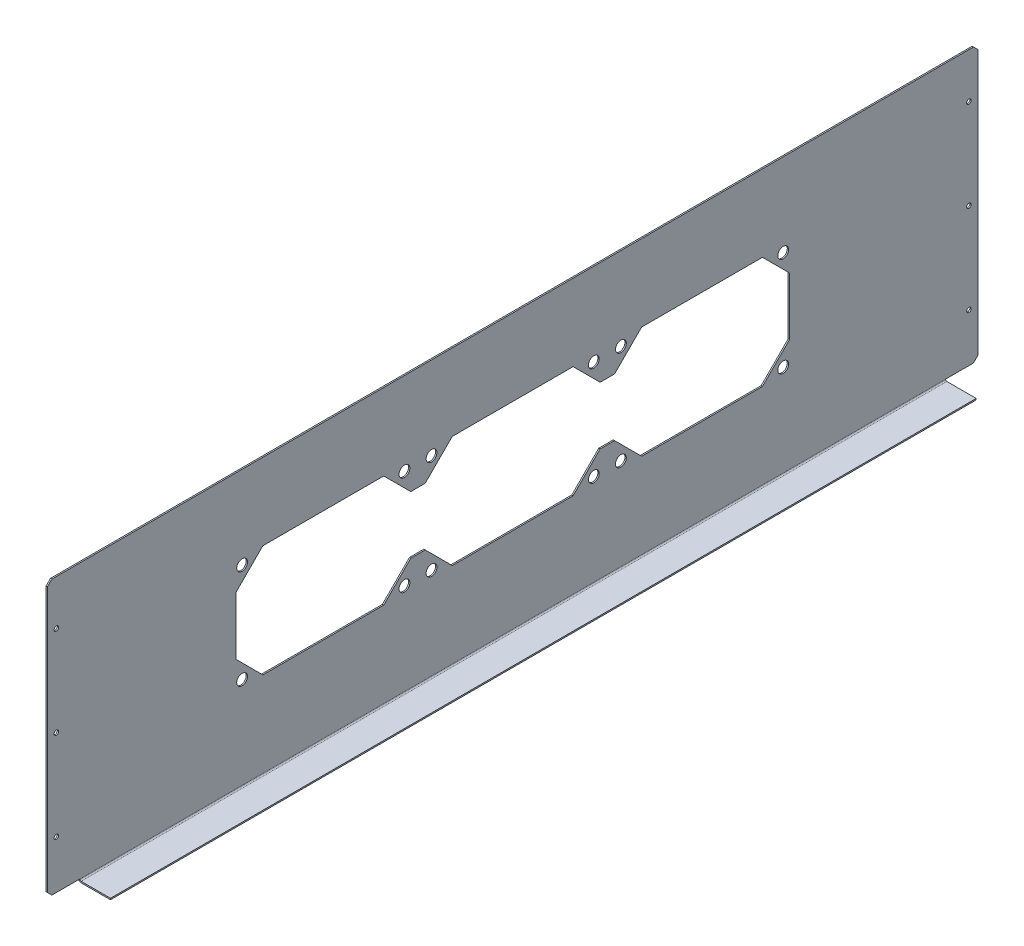
from build123d import *

# Parameters (mm, degrees)
SM_BASE_FLANGE_1_DEPTH = 516
SKETCH_7_W             = 36
SKETCH_7_H             = 3
CUT_EXTRUDE_1_DEPTH    = 601.450872262
OTHER_START            = -1.5
OTHER_1_DEPTH          = 1.5
SKETCH_8_R             = 6
CUT_EXTRUDE_1446_DEPTH = 10
PATTERN_LINEAR_1_COUNT = 3
PATTERN_LINEAR_1_PITCH = 210
SKETCH_9_R             = 2.5
CUT_EXTRUDE_3_DEPTH    = 10
SKETCH_10_W            = 16
SKETCH_10_H            = 64
CUT_EXTRUDE_4_DEPTH    = 10


# Read off the part's stored shape, not the designer's step: Затупленный угол1
# Sheet-metal steps are written as plain solids
with BuildPart() as part:
    # Sketch 1 → Базовая кромка1 (new, symmetric)
    with BuildSketch(Plane.XY):
        with BuildLine():
            Line((0, 305), (0, 1.5))
            ThreePointArc((0, 1.5), (0.439339828, 0.439339828), (1.5, 0))
            Line((1.5, 0), (34, 0))
            Line((34, 0), (34, -1.5))
            Line((34, -1.5), (1.5, -1.5))
            ThreePointArc((1.5, -1.5), (-0.621320344, -0.621320344), (-1.5, 1.5))
            Line((-1.5, 1.5), (-1.5, 305))
            Line((-1.5, 305), (0, 305))
        make_face()
    extrude(amount=SM_BASE_FLANGE_1_DEPTH, both=True)

    # Эскиз7 → Вырез-Вытянуть1 (cut, through all)
    with BuildSketch(Plane.ZY.offset(1.5)):
        with Locations((-498, 0)):
            Rectangle(SKETCH_7_W, SKETCH_7_H)
        with Locations((498, 0)):
            Rectangle(SKETCH_7_W, SKETCH_7_H)
    extrude(amount=-CUT_EXTRUDE_1_DEPTH, mode=Mode.SUBTRACT)

    # Other 1 outline → Other 1 (cut)
    with BuildSketch(Plane.YZ.offset(OTHER_START)):
        Polygon((1.5, 516), (1.5, 511), (6.5, 516), align=None)
        Polygon((1.5, -516), (6.5, -516), (1.5, -511), align=None)
        Polygon((305, -516), (305, -511), (300, -516), align=None)
        Polygon((305, 516), (300, 516), (305, 511), align=None)
    extrude(amount=OTHER_1_DEPTH, mode=Mode.SUBTRACT)

    # Эскиз8 → Cut-Extrude 1446 (cut)
    with BuildSketch(Plane(origin=(0, 0, 0), x_dir=(0, 0, -1), z_dir=(1, 0, 0))):
        with Locations(Location((-300, 213, 0), (0, 0, 90))):
            Circle(SKETCH_8_R)
        with Locations(Location((-300, 103, 0), (0, 0, 90))):
            Circle(SKETCH_8_R)
        with Locations(Location((-120, 103, 0), (0, 0, 90))):
            Circle(SKETCH_8_R)
        with Locations(Location((-120, 213, 0), (0, 0, 90))):
            Circle(SKETCH_8_R)
        Polygon((-307, 126), (-277, 96), (-143, 96), (-113, 126), (-113, 190), (-143, 220), (-277, 220), (-307, 190), align=None)
    cut_extrude_1446 = extrude(amount=-CUT_EXTRUDE_1446_DEPTH, mode=Mode.SUBTRACT)

    # Линейный массив1: Cut-Extrude 1446 ×3
    with Locations(*[(0, 0, -i * PATTERN_LINEAR_1_PITCH) for i in range(1, PATTERN_LINEAR_1_COUNT)]):
        add(cut_extrude_1446, mode=Mode.SUBTRACT)

    # Эскиз9 → Вырез-Вытянуть3 (cut)
    with BuildSketch(Plane(origin=(0, 0, 0), x_dir=(0, 0, -1), z_dir=(1, 0, 0))):
        with Locations(Location((-506, 255, 0), (0, 0, 90))):
            Circle(SKETCH_9_R)
        with Locations(Location((-506, 155, 0), (0, 0, 90))):
            Circle(SKETCH_9_R)
        with Locations(Location((-506, 55, 0), (0, 0, 90))):
            Circle(SKETCH_9_R)
        with Locations(Location((506, 55, 0), (0, 0, 270))):
            Circle(SKETCH_9_R)
        with Locations(Location((506, 155, 0), (0, 0, 270))):
            Circle(SKETCH_9_R)
        with Locations(Location((506, 255, 0), (0, 0, 270))):
            Circle(SKETCH_9_R)
    extrude(amount=-CUT_EXTRUDE_3_DEPTH, mode=Mode.SUBTRACT)

    # Эскиз10 → Вырез-Вытянуть4 (cut)
    with BuildSketch(Plane(origin=(0, 0, 0), x_dir=(0, 0, -1), z_dir=(1, 0, 0))):
        with Locations((-105, 158)):
            Rectangle(SKETCH_10_W, SKETCH_10_H)
        with Locations((105, 158)):
            Rectangle(SKETCH_10_W, SKETCH_10_H)
    extrude(amount=-CUT_EXTRUDE_4_DEPTH, mode=Mode.SUBTRACT)


solid = part.part
